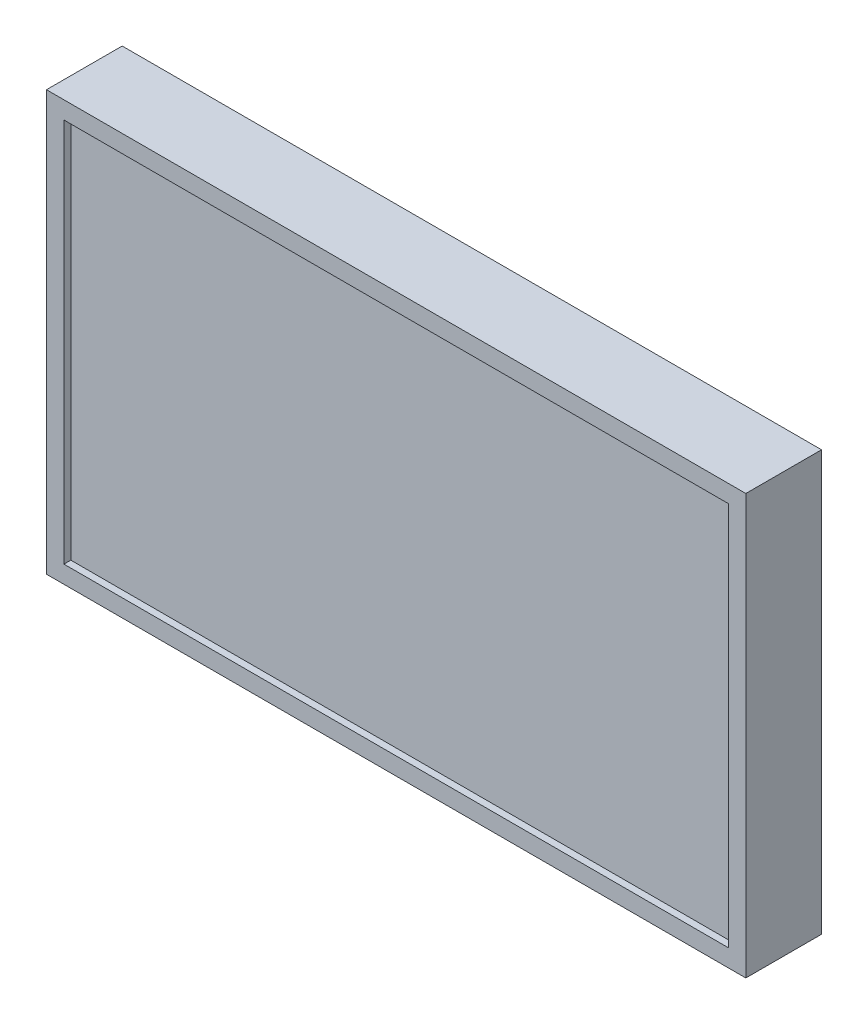
from build123d import *

# Parameters (mm, degrees)
SKETCH2_W                 = 508
SKETCH2_H                 = 304.8
BOSS_EXTRUDE1_DEPTH       = 55
M6X1_0_TAPPED_HOLE1_D     = 5
M6X1_0_TAPPED_HOLE1_DEPTH = 17
M6X1_0_TAPPED_HOLE1_TIP   = 1.502151548
SKETCH6_W                 = 482.6
SKETCH6_H                 = 279.4
CUT_EXTRUDE1_DEPTH        = 5


with BuildPart() as part:
    # Sketch2 → Boss-Extrude1 (new body)
    with BuildSketch(Plane.XY):
        Rectangle(SKETCH2_W, SKETCH2_H)
    extrude(amount=BOSS_EXTRUDE1_DEPTH)

    # M6x1.0 Tapped Hole1
    with Locations(Plane(origin=(0, 0, 0), x_dir=(-1, 0, 0), z_dir=(0, 0, -1))):
        with Locations((50, 50), (-50, -50), (-50, 50), (50, -50)):
            Hole(M6X1_0_TAPPED_HOLE1_D / 2, depth=M6X1_0_TAPPED_HOLE1_DEPTH)
            with Locations((0, 0, -(M6X1_0_TAPPED_HOLE1_DEPTH + M6X1_0_TAPPED_HOLE1_TIP / 2))):  # 118° drill point
                Cone(0, M6X1_0_TAPPED_HOLE1_D / 2, M6X1_0_TAPPED_HOLE1_TIP, mode=Mode.SUBTRACT)

    # Sketch6 → Cut-Extrude1 (cut)
    with BuildSketch(Plane.XY.offset(55)):
        Rectangle(SKETCH6_W, SKETCH6_H)
    extrude(amount=-CUT_EXTRUDE1_DEPTH, mode=Mode.SUBTRACT)


solid = part.part
